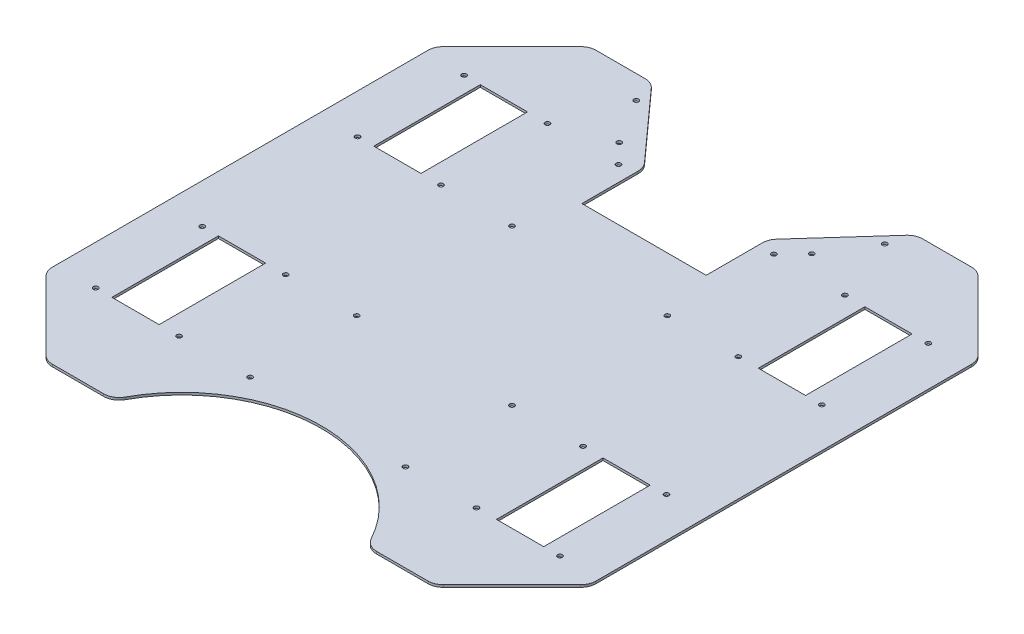
from build123d import *

# Parameters (mm, degrees)
SKETCH_1_R      = 1.55
SKETCH_1_W      = 30.4
SKETCH_1_H      = 68.58
EXTRUDE_1_DEPTH = 1.5
FILLET_1_R      = 10
FILLET_2_R      = 10
FILLET_3_R      = 10


with BuildPart() as part:
    # 草图1 → 凸台-拉伸1 (new body)
    with BuildSketch(Plane(origin=(0, 0, 0), x_dir=(1, 0, 0), z_dir=(0, 1, 0))):
        with BuildLine():
            Line((-125, 175), (-175, 125))
            Line((-175, 125), (-175, -125))
            Line((-175, -125), (-125, -175))
            Line((-125, -175), (-81.710313025, -175))
            ThreePointArc((-81.710313025, -175), (0, -122.728301649), (81.710313025, -175))
            Line((81.710313025, -175), (125, -175))
            Line((125, -175), (175, -125))
            Line((175, -125), (175, 125))
            Line((175, 125), (125, 175))
            Line((125, 175), (85, 175))
            Line((85, 175), (40, 125))
            Line((40, 125), (40, 85))
            Line((40, 85), (-40, 85))
            Line((-40, 85), (-40, 125))
            Line((-40, 125), (-85, 175))
            Line((-85, 175), (-125, 175))
        make_face()
        with Locations((-62, 131)):
            Circle(SKETCH_1_R, mode=Mode.SUBTRACT)
        with Locations((-80, 160)):
            Circle(SKETCH_1_R, mode=Mode.SUBTRACT)
        with Locations((62, 131)):
            Circle(SKETCH_1_R, mode=Mode.SUBTRACT)
        with Locations((80, 160)):
            Circle(SKETCH_1_R, mode=Mode.SUBTRACT)
        with Locations((-50, 118.58)):
            Circle(SKETCH_1_R, mode=Mode.SUBTRACT)
        with Locations((-50, 50)):
            Circle(SKETCH_1_R, mode=Mode.SUBTRACT)
        with Locations((-95.72, 50)):
            Circle(SKETCH_1_R, mode=Mode.SUBTRACT)
        with Locations((-95.72, 118.58)):
            Circle(SKETCH_1_R, mode=Mode.SUBTRACT)
        with Locations((-149.434, 118.58)):
            Circle(SKETCH_1_R, mode=Mode.SUBTRACT)
        with Locations((-149.434, 50)):
            Circle(SKETCH_1_R, mode=Mode.SUBTRACT)
        with Locations((-50, -118.58)):
            Circle(SKETCH_1_R, mode=Mode.SUBTRACT)
        with Locations((-50, -50)):
            Circle(SKETCH_1_R, mode=Mode.SUBTRACT)
        with Locations((-95.72, -50)):
            Circle(SKETCH_1_R, mode=Mode.SUBTRACT)
        with Locations((-95.72, -118.58)):
            Circle(SKETCH_1_R, mode=Mode.SUBTRACT)
        with Locations((-149.434, -50)):
            Circle(SKETCH_1_R, mode=Mode.SUBTRACT)
        with Locations((-149.434, -118.58)):
            Circle(SKETCH_1_R, mode=Mode.SUBTRACT)
        with Locations((50, 50)):
            Circle(SKETCH_1_R, mode=Mode.SUBTRACT)
        with Locations((95.72, 50)):
            Circle(SKETCH_1_R, mode=Mode.SUBTRACT)
        with Locations((95.72, 118.58)):
            Circle(SKETCH_1_R, mode=Mode.SUBTRACT)
        with Locations((50, 118.58)):
            Circle(SKETCH_1_R, mode=Mode.SUBTRACT)
        with Locations((149.434, 118.58)):
            Circle(SKETCH_1_R, mode=Mode.SUBTRACT)
        with Locations((149.434, 50)):
            Circle(SKETCH_1_R, mode=Mode.SUBTRACT)
        with Locations((149.434, -118.58)):
            Circle(SKETCH_1_R, mode=Mode.SUBTRACT)
        with Locations((149.434, -50)):
            Circle(SKETCH_1_R, mode=Mode.SUBTRACT)
        with Locations((95.72, -50)):
            Circle(SKETCH_1_R, mode=Mode.SUBTRACT)
        with Locations((95.72, -118.58)):
            Circle(SKETCH_1_R, mode=Mode.SUBTRACT)
        with Locations((50, -118.58)):
            Circle(SKETCH_1_R, mode=Mode.SUBTRACT)
        with Locations((50, -50)):
            Circle(SKETCH_1_R, mode=Mode.SUBTRACT)
        with Locations((-123.794, 84.29)):
            Rectangle(SKETCH_1_W, SKETCH_1_H, mode=Mode.SUBTRACT)
        with Locations((123.794, 84.29)):
            Rectangle(SKETCH_1_W, SKETCH_1_H, mode=Mode.SUBTRACT)
        with Locations((-123.794, -84.29)):
            Rectangle(SKETCH_1_W, SKETCH_1_H, mode=Mode.SUBTRACT)
        with Locations((123.794, -84.29)):
            Rectangle(SKETCH_1_W, SKETCH_1_H, mode=Mode.SUBTRACT)
    extrude(amount=EXTRUDE_1_DEPTH)

    # 圆角1
    fillet_1_edges = [part.edges().sort_by_distance(p)[0] for p in [
        (-40, 0.75, -125),
    ]]
    fillet(fillet_1_edges, radius=FILLET_1_R)

    # 圆角2
    fillet_2_edges = [part.edges().sort_by_distance(p)[0] for p in [
        (40, 0.75, -125),
    ]]
    fillet(fillet_2_edges, radius=FILLET_2_R)

    # 圆角3
    fillet_3_edges = [part.edges().sort_by_distance(p)[0] for p in [
        (-85, 0.75, -175),
        (85, 0.75, -175),
        (125, 0.75, -175),
        (175, 0.75, -125),
        (175, 0.75, 125),
        (125, 0.75, 175),
        (81.710313025, 0.75, 175),
        (-81.710313025, 0.75, 175),
        (-125, 0.75, 175),
        (-175, 0.75, 125),
        (-175, 0.75, -125),
        (-125, 0.75, -175),
    ]]
    fillet(fillet_3_edges, radius=FILLET_3_R)


solid = part.part
